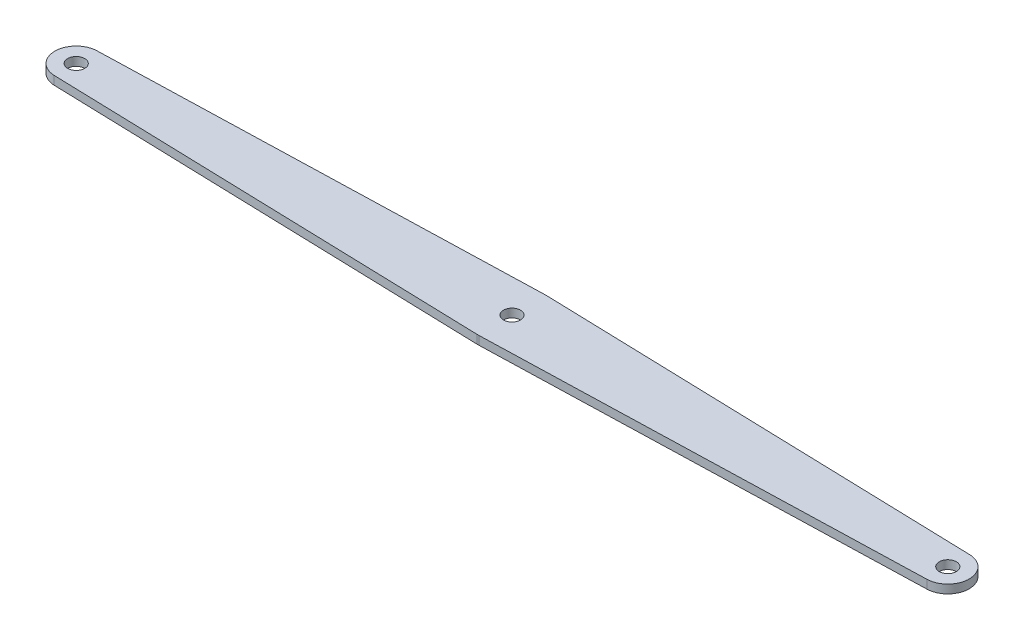
from build123d import *

# Parameters (mm, degrees)
EXTRUDE_446_DEPTH     = 2
SKETCH_2_R            = 2
CUT_EXTRUDE_657_DEPTH = 108.317028643
SKETCH_3_R            = 2
CUT_EXTRUDE_883_DEPTH = 108.317028643


with BuildPart() as part:
    # Эскиз1 → Extrude 446 (new body)
    with BuildSketch(Plane(origin=(0, 0, 0), x_dir=(1, 0, 0), z_dir=(0, 1, 0))):
        with BuildLine():
            Line((-102.147058824, 4.997836902), (-0.235294118, 7.996539044))
            Line((-0.235294118, 7.996539044), (0.235294118, 7.996539044))
            Line((0.235294118, 7.996539044), (102.147058824, 4.997836902))
            ThreePointArc((102.147058824, 4.997836902), (107, 0), (102.147058824, -4.997836902))
            Line((102.147058824, -4.997836902), (0.235294118, -7.996539044))
            Line((0.235294118, -7.996539044), (-0.235294118, -7.996539044))
            Line((-0.235294118, -7.996539044), (-102.147058824, -4.997836902))
            ThreePointArc((-102.147058824, -4.997836902), (-107, 0), (-102.147058824, 4.997836902))
        make_face()
    extrude(amount=EXTRUDE_446_DEPTH)

    # Эскиз2 → Cut-Extrude 657 (cut, through all)
    with BuildSketch(Plane(origin=(0, 2, 0), x_dir=(1, 0, 0), z_dir=(0, 1, 0))):
        Circle(SKETCH_2_R)
    extrude(amount=-CUT_EXTRUDE_657_DEPTH, mode=Mode.SUBTRACT)

    # Эскиз3 → Cut-Extrude 883 (cut, through all)
    with BuildSketch(Plane(origin=(0, 2, 0), x_dir=(1, 0, 0), z_dir=(0, 1, 0))):
        with Locations((-102, 0)):
            Circle(SKETCH_3_R)
        with Locations((102, 0)):
            Circle(SKETCH_3_R)
    extrude(amount=-CUT_EXTRUDE_883_DEPTH, mode=Mode.SUBTRACT)


solid = part.part
